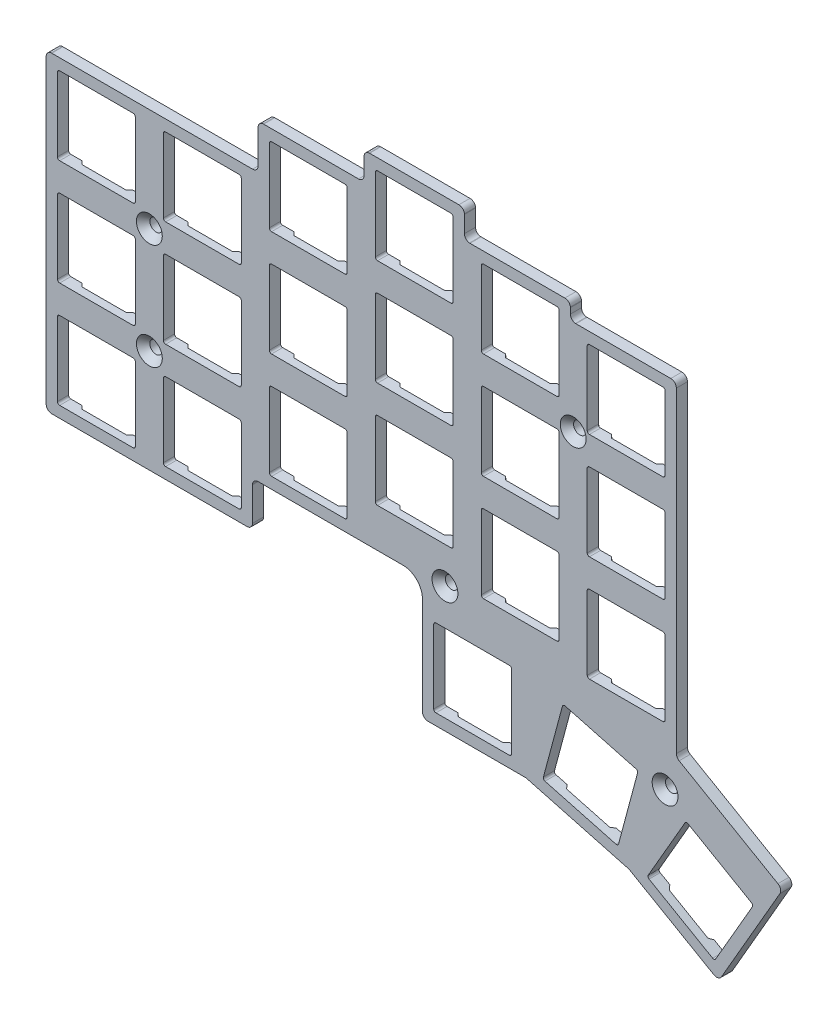
from build123d import *

# Parameters (mm, degrees)
BOSS_EXTRUDE1_START          = 5
BOSS_EXTRUDE1_DEPTH          = 2
CUT_EXTRUDE1_DEPTH           = 3
CUT_EXTRUDE2_DEPTH           = 3
CUT_EXTRUDE3_DEPTH           = 3
SKETCH6_R                    = 1.125
CUT_EXTRUDE4_DEPTH           = 3
CHAMFER3_SIZE                = 1.2
CUT_EXTRUDE5_DEPTH           = 0.6
CHAMFER6_SIZE                = 0.6
CUT_EXTRUDE6_DEPTH           = 0.6
CHAMFER7_SIZE                = 0.6
CIRPATTERN2_COUNT            = 3
CIRPATTERN2_ANGLE            = 30
CHAMFER7_OF_CIRPATTERN2_SIZE = 0.6
SKETCH_PATTERN4_DEPTH        = 0.6
SKETCH_PATTERN4_TAPER        = -45
SKETCH_PATTERN4_2_DEPTH      = 0.6
SKETCH_PATTERN4_2_TAPER      = -45
SKETCH_PATTERN4_3_DEPTH      = 0.6
SKETCH_PATTERN4_3_TAPER      = -45
SKETCH_PATTERN4_4_DEPTH      = 0.6
SKETCH_PATTERN4_4_TAPER      = -45
SKETCH_PATTERN4_5_DEPTH      = 0.6
SKETCH_PATTERN4_5_TAPER      = -45
SKETCH_PATTERN4_6_DEPTH      = 0.6
SKETCH_PATTERN4_6_TAPER      = -45
SKETCH_PATTERN4_7_DEPTH      = 0.6
SKETCH_PATTERN4_7_TAPER      = -45
SKETCH_PATTERN4_8_DEPTH      = 0.6
SKETCH_PATTERN4_8_TAPER      = -45
SKETCH_PATTERN4_9_DEPTH      = 0.6
SKETCH_PATTERN4_9_TAPER      = -45
SKETCH_PATTERN4_10_DEPTH     = 0.6
SKETCH_PATTERN4_10_TAPER     = -45
SKETCH_PATTERN4_11_DEPTH     = 0.6
SKETCH_PATTERN4_11_TAPER     = -45
SKETCH_PATTERN4_12_DEPTH     = 0.6
SKETCH_PATTERN4_12_TAPER     = -45
SKETCH_PATTERN4_13_DEPTH     = 0.6
SKETCH_PATTERN4_13_TAPER     = -45
SKETCH_PATTERN4_14_DEPTH     = 0.6
SKETCH_PATTERN4_14_TAPER     = -45
SKETCH_PATTERN4_15_DEPTH     = 0.6
SKETCH_PATTERN4_15_TAPER     = -45
SKETCH_PATTERN4_16_DEPTH     = 0.6
SKETCH_PATTERN4_16_TAPER     = -45
SKETCH_PATTERN4_17_DEPTH     = 0.6
SKETCH_PATTERN4_17_TAPER     = -45
SKETCH_PATTERN4_18_DEPTH     = 0.6
SKETCH_PATTERN4_18_TAPER     = -45
SKETCH_PATTERN4_19_DEPTH     = 0.6
SKETCH_PATTERN4_19_TAPER     = -45
SKETCH_PATTERN4_20_DEPTH     = 0.6
SKETCH_PATTERN4_20_TAPER     = -45
SKETCH_PATTERN4_21_DEPTH     = 0.6
SKETCH_PATTERN4_21_TAPER     = -45
SKETCH_PATTERN4_22_DEPTH     = 0.6
SKETCH_PATTERN4_22_TAPER     = -45
SKETCH_PATTERN4_23_DEPTH     = 0.6
SKETCH_PATTERN4_23_TAPER     = -45
SKETCH_PATTERN4_24_DEPTH     = 0.6
SKETCH_PATTERN4_24_TAPER     = -45
SKETCH_PATTERN4_25_DEPTH     = 0.6
SKETCH_PATTERN4_25_TAPER     = -45
SKETCH_PATTERN4_26_DEPTH     = 0.6
SKETCH_PATTERN4_26_TAPER     = -45
SKETCH_PATTERN4_27_DEPTH     = 0.6
SKETCH_PATTERN4_27_TAPER     = -45
SKETCH_PATTERN4_28_DEPTH     = 0.6
SKETCH_PATTERN4_28_TAPER     = -45
SKETCH_PATTERN4_29_DEPTH     = 0.6
SKETCH_PATTERN4_29_TAPER     = -45
SKETCH_PATTERN4_30_DEPTH     = 0.6
SKETCH_PATTERN4_30_TAPER     = -45
SKETCH_PATTERN4_31_DEPTH     = 0.6
SKETCH_PATTERN4_31_TAPER     = -45
SKETCH_PATTERN4_32_DEPTH     = 0.6
SKETCH_PATTERN4_32_TAPER     = -45
SKETCH_PATTERN4_33_DEPTH     = 0.6
SKETCH_PATTERN4_33_TAPER     = -45
SKETCH_PATTERN4_34_DEPTH     = 0.6
SKETCH_PATTERN4_34_TAPER     = -45
BOSS_EXTRUDE2_START          = 0.9
SKETCH12_R                   = 1.75
SKETCH12_R_2                 = 1.125
BOSS_EXTRUDE2_DEPTH          = 0.9
CHAMFER8_SIZE                = 0.5


with BuildPart() as part:
    # Sketch1 → Boss-Extrude1 (new body)
    with BuildSketch(Plane.XY.offset(BOSS_EXTRUDE1_START)):
        with BuildLine():
            Line((-43.412279, 85.144111), (-59.462279, 85.144111))
            Line((-59.462279, 85.144111), (-59.560533, 85.141704))
            ThreePointArc((-59.560533, 85.141704), (-60.204711116, 84.817640196), (-60.462279, 84.144111))
            Line((-60.462279, 84.144111), (-60.462279, 81.144111))
            Line((-60.462279, 81.144111), (-60.464686, 81.045857))
            ThreePointArc((-60.464686, 81.045857), (-60.788749804, 80.401678884), (-61.462279, 80.144111))
            Line((-61.462279, 80.144111), (-67.612279, 80.144111))
            Line((-67.612279, 80.144111), (-72.362279, 80.144111))
            Line((-72.362279, 80.144111), (-78.512279, 80.144111))
            Line((-78.512279, 80.144111), (-78.610533, 80.141704))
            ThreePointArc((-78.610533, 80.141704), (-79.254711116, 79.817640196), (-79.512279, 79.144111))
            Line((-79.512279, 79.144111), (-79.512279, 73.144111))
            Line((-79.512279, 73.144111), (-79.514686, 73.045857))
            ThreePointArc((-79.514686, 73.045857), (-79.838749804, 72.401678884), (-80.512279, 72.144111))
            Line((-80.512279, 72.144111), (-116.612279, 72.144111))
            Line((-116.612279, 72.144111), (-116.710533, 72.141704))
            ThreePointArc((-116.710533, 72.141704), (-117.354711116, 71.817640196), (-117.612279, 71.144111))
            Line((-117.612279, 71.144111), (-117.612279, 16.994111))
            Line((-117.612279, 16.994111), (-117.609872, 16.895857))
            ThreePointArc((-117.609872, 16.895857), (-117.285808196, 16.251678884), (-116.612279, 15.994111))
            Line((-116.612279, 15.994111), (-101.437279, 15.994111))
            Line((-101.437279, 15.994111), (-96.687279, 15.994111))
            Line((-96.687279, 15.994111), (-81.512279, 15.994111))
            Line((-81.512279, 15.994111), (-81.414025, 15.996518))
            ThreePointArc((-81.414025, 15.996518), (-80.769846884, 16.320581804), (-80.512279, 16.994111))
            Line((-80.512279, 16.994111), (-80.512279, 22.994111))
            Line((-80.512279, 22.994111), (-80.509872, 23.092365))
            ThreePointArc((-80.509872, 23.092365), (-80.185808196, 23.736543116), (-79.512279, 23.994111))
            Line((-79.512279, 23.994111), (-53.462279, 23.994111))
            Line((-53.462279, 23.994111), (-53.278977, 23.991713))
            ThreePointArc((-53.278977, 23.991713), (-50.922055604, 22.905352629), (-49.962279, 20.494111))
            Line((-49.962279, 20.494111), (-49.962279, 2.944111))
            Line((-49.962279, 2.944111), (-49.959872, 2.845857))
            ThreePointArc((-49.959872, 2.845857), (-49.635808196, 2.201678884), (-48.962279, 1.944111))
            Line((-48.962279, 1.944111), (-31.346453, 1.944111))
            Line((-31.346453, 1.944111), (-12.818399, -3.020466))
            Line((-12.818399, -3.020466), (2.437354, -11.828379))
            Line((2.437354, -11.828379), (2.523644, -11.875428))
            ThreePointArc((2.523644, -11.875428), (3.24353, -11.916930612), (3.803337, -11.462426))
            Line((3.803337, -11.462426), (17.333763, 11.972959))
            Line((17.333763, 11.972959), (17.375769, 12.049527))
            ThreePointArc((17.375769, 12.049527), (17.445855835, 12.255982525), (17.467721, 12.472911))
            Line((17.467721, 12.472911), (17.467721, 76.144111))
            Line((17.467721, 76.144111), (17.465314, 76.242365))
            ThreePointArc((17.465314, 76.242365), (17.141250196, 76.886543116), (16.467721, 77.144111))
            Line((16.467721, 77.144111), (-22.362279, 77.144111))
            Line((-22.362279, 77.144111), (-22.460533, 77.146518))
            ThreePointArc((-22.460533, 77.146518), (-23.104711116, 77.470581804), (-23.362279, 78.144111))
            Line((-23.362279, 78.144111), (-23.362279, 79.144111))
            Line((-23.362279, 79.144111), (-23.364686, 79.242365))
            ThreePointArc((-23.364686, 79.242365), (-23.688749804, 79.886543116), (-24.362279, 80.144111))
            Line((-24.362279, 80.144111), (-30.512279, 80.144111))
            Line((-30.512279, 80.144111), (-35.262279, 80.144111))
            Line((-35.262279, 80.144111), (-41.412279, 80.144111))
            Line((-41.412279, 80.144111), (-41.510533, 80.146518))
            ThreePointArc((-41.510533, 80.146518), (-42.154711116, 80.470581804), (-42.412279, 81.144111))
            Line((-42.412279, 81.144111), (-42.412279, 84.144111))
            Line((-42.412279, 84.144111), (-42.414686, 84.242365))
            ThreePointArc((-42.414686, 84.242365), (-42.738749804, 84.886543116), (-43.412279, 85.144111))
        make_face()
    extrude(amount=-BOSS_EXTRUDE1_DEPTH)

    # Sketch2 → Cut-Extrude1 (cut)
    with BuildSketch(Plane.XY.offset(5)):
        with BuildLine():
            Line((-101.987279, 56.119111), (-115.187279, 56.119111))
            ThreePointArc((-115.187279, 56.119111), (-115.470121712, 56.236268288), (-115.587279, 56.519111))
            Line((-115.587279, 56.519111), (-115.587279, 69.719111))
            ThreePointArc((-115.587279, 69.719111), (-115.470121712, 70.001953712), (-115.187279, 70.119111))
            Line((-115.187279, 70.119111), (-101.987279, 70.119111))
            ThreePointArc((-101.987279, 70.119111), (-101.704436288, 70.001953712), (-101.587279, 69.719111))
            Line((-101.587279, 69.719111), (-101.587279, 56.519111))
            ThreePointArc((-101.587279, 56.519111), (-101.704436288, 56.236268288), (-101.987279, 56.119111))
        make_face()
    cut_extrude1 = extrude(amount=-CUT_EXTRUDE1_DEPTH, mode=Mode.SUBTRACT)

    # Sketch-Pattern1: Cut-Extrude1 at 18 more places
    with Locations((0, -38.1, 0), (0, -19.05, 0), (19.05, -38.1, 0), (19.05, -19.05, 0), (19.05, 0, 0), (38.1, -11.05, 0), (38.1, -30.1, 0), (57.15, -25.1, 0), (57.15, -6.05, 0), (57.15, 13, 0), (38.1, 8, 0), (76.2, 8, 0), (76.2, -11.05, 0), (76.2, -30.1, 0), (67.65, -52.15, 0), (95.25, -33.1, 0), (95.25, -14.05, 0), (95.25, 5, 0)):
        add(cut_extrude1, mode=Mode.SUBTRACT)

    # Sketch4 → Cut-Extrude2 (cut)
    with BuildSketch(Plane.XY.offset(5)):
        with BuildLine():
            Line((-24.309961183, 16.648989457), (-11.559740258, 13.23257813))
            ThreePointArc((-11.559740258, 13.23257813), (-11.316857713, 13.046207801), (-11.276897543, 12.742680183))
            Line((-11.276897543, 12.742680183), (-14.69330887, -0.007540742))
            ThreePointArc((-14.69330887, -0.007540742), (-14.879679199, -0.250423287), (-15.183206817, -0.290383457))
            Line((-15.183206817, -0.290383457), (-27.933427742, 3.12602787))
            ThreePointArc((-27.933427742, 3.12602787), (-28.176310287, 3.312398199), (-28.216270457, 3.615925817))
            Line((-28.216270457, 3.615925817), (-24.79985913, 16.366146742))
            ThreePointArc((-24.79985913, 16.366146742), (-24.613488801, 16.609029287), (-24.309961183, 16.648989457))
        make_face()
        with BuildLine():
            Line((2.215767665, -9.362177826), (-9.215767665, -2.762177826))
            ThreePointArc((-9.215767665, -2.762177826), (-9.402137995, -2.519295283), (-9.362177826, -2.215767665))
            Line((-9.362177826, -2.215767665), (-2.762177826, 9.215767665))
            ThreePointArc((-2.762177826, 9.215767665), (-2.519295283, 9.402137995), (-2.215767665, 9.362177826))
            Line((-2.215767665, 9.362177826), (9.215767665, 2.762177826))
            ThreePointArc((9.215767665, 2.762177826), (9.402137995, 2.519295283), (9.362177826, 2.215767665))
            Line((9.362177826, 2.215767665), (2.762177826, -9.215767665))
            ThreePointArc((2.762177826, -9.215767665), (2.519295283, -9.402137995), (2.215767665, -9.362177826))
        make_face()
    extrude(amount=-CUT_EXTRUDE2_DEPTH, mode=Mode.SUBTRACT)

    # Sketch5 → Cut-Extrude3 (cut)
    with BuildSketch(Plane.XY.offset(5)):
        with BuildLine():
            Line((-12.903744032, 77.144111), (-5.312279, 77.144111))
            ThreePointArc((-5.312279, 77.144111), (-4.605172219, 76.851217781), (-4.312279, 76.144111))
            Line((-4.312279, 76.144111), (-4.312279, 19.232853248))
            ThreePointArc((-4.312279, 19.232853248), (-4.178304404, 18.732853248), (-3.812279, 18.366827844))
            Line((-3.812279, 18.366827844), (13.949853399, 8.111855922))
            ThreePointArc((13.949853399, 8.111855922), (14.415779225, 7.504649564), (14.315878803, 6.745830519))
            Line((14.315878803, 6.745830519), (7.754308024, -4.619143447))
            Line((7.754308024, -4.619143447), (24.75284052, -3.869886779))
            Line((24.75284052, -3.869886779), (24.75284052, 82.882476135))
            Line((24.75284052, 82.882476135), (-12.903744032, 94.38391813))
            Line((-12.903744032, 94.38391813), (-12.903744032, 77.144111))
        make_face()
    extrude(amount=-CUT_EXTRUDE3_DEPTH, mode=Mode.SUBTRACT)

    # Sketch6 → Cut-Extrude4 (cut)
    with BuildSketch(Plane(origin=(0, 0, 3), x_dir=(-1, 0, 0), z_dir=(0, 0, -1))):
        with Locations((99.062279, 34.544111)):
            Circle(SKETCH6_R)
        with Locations((99.062279, 53.594111)):
            Circle(SKETCH6_R)
        with Locations((45.912279, 24.494111)):
            Circle(SKETCH6_R)
        with Locations((6.333841, 12.634642)):
            Circle(SKETCH6_R)
        with Locations((22.862279, 60.094111)):
            Circle(SKETCH6_R)
    extrude(amount=-CUT_EXTRUDE4_DEPTH, mode=Mode.SUBTRACT)

    # Chamfer3
    chamfer3_edges = [part.edges().sort_by_distance(p)[0] for p in [
        (-21.737279, 60.094111, 5),
        (-5.208841, 12.634642, 5),
        (-44.787279, 24.494111, 5),
        (-97.937279, 53.594111, 5),
        (-97.937279, 34.544111, 5),
    ]]
    chamfer(chamfer3_edges, length=CHAMFER3_SIZE)

    # Sketch7 → Cut-Extrude5 (cut)
    with BuildSketch(Plane(origin=(0, 0, 3), x_dir=(-1, 0, 0), z_dir=(0, 0, -1))):
        with BuildLine():
            Line((111.787279, 71.119111), (105.387279, 71.119111))
            ThreePointArc((105.387279, 71.119111), (104.821593575, 70.884796425), (104.587279, 70.319111))
            Line((104.587279, 70.319111), (104.587279, 55.919111))
            ThreePointArc((104.587279, 55.919111), (104.821593575, 55.353425575), (105.387279, 55.119111))
            Line((105.387279, 55.119111), (111.787279, 55.119111))
            ThreePointArc((111.787279, 55.119111), (112.352964425, 55.353425575), (112.587279, 55.919111))
            Line((112.587279, 55.919111), (112.587279, 70.319111))
            ThreePointArc((112.587279, 70.319111), (112.352964425, 70.884796425), (111.787279, 71.119111))
        make_face()
    extrude(amount=-CUT_EXTRUDE5_DEPTH, mode=Mode.SUBTRACT)

    # Chamfer6
    chamfer6_edges = [part.edges().sort_by_distance(p)[0] for p in [
        (-104.587279, 56.019111, 3),
        (-112.587279, 56.019111, 3),
        (-104.821593575, 55.353425575, 3),
        (-112.352964425, 55.353425575, 3),
        (-108.587279, 55.119111, 3),
        (-112.587279, 70.219111, 3),
        (-104.587279, 70.219111, 3),
        (-112.352964425, 70.884796425, 3),
        (-104.821593575, 70.884796425, 3),
        (-108.587279, 71.119111, 3),
    ]]
    chamfer(chamfer6_edges, length=CHAMFER6_SIZE - 0.0001)  # a hair under: the kernel refuses the full size

    # Sketch10 → Cut-Extrude6 (cut)
    with BuildSketch(Plane(origin=(0, 0, 3), x_dir=(-1, 0, 0), z_dir=(0, 0, -1))):
        with BuildLine():
            Line((44.137279, 18.969111), (37.737279, 18.969111))
            ThreePointArc((37.737279, 18.969111), (37.171593575, 18.734796425), (36.937279, 18.169111))
            Line((36.937279, 18.169111), (36.937279, 3.769111))
            ThreePointArc((36.937279, 3.769111), (37.171593575, 3.203425575), (37.737279, 2.969111))
            Line((37.737279, 2.969111), (44.137279, 2.969111))
            ThreePointArc((44.137279, 2.969111), (44.702964425, 3.203425575), (44.937279, 3.769111))
            Line((44.937279, 3.769111), (44.937279, 18.169111))
            ThreePointArc((44.937279, 18.169111), (44.702964425, 18.734796425), (44.137279, 18.969111))
        make_face()
    cut_extrude6 = extrude(amount=-CUT_EXTRUDE6_DEPTH, mode=Mode.SUBTRACT)

    # Chamfer7
    chamfer7_edges = [part.edges().sort_by_distance(p)[0] for p in [
        (-36.937279, 3.869111, 3),
        (-36.937279, 18.069111, 3),
        (-44.937279, 3.869111, 3),
        (-37.171593575, 3.203425575, 3),
        (-44.702964425, 3.203425575, 3),
        (-40.937279, 2.969111, 3),
        (-44.937279, 18.069111, 3),
        (-44.702964425, 18.734796425, 3),
        (-37.171593575, 18.734796425, 3),
        (-40.937279, 18.969111, 3),
    ]]
    chamfer(chamfer7_edges, length=CHAMFER7_SIZE - 0.0001)  # a hair under: the kernel refuses the full size

    # CirPattern2: Cut-Extrude6 ×3 about axis
    cirpattern2_axis = Axis((-40.937279, -70.90544602, 0), (0, 0, -1))
    for i in range(1, CIRPATTERN2_COUNT):
        add(cut_extrude6.rotate(cirpattern2_axis, i * CIRPATTERN2_ANGLE / (CIRPATTERN2_COUNT - 1)), mode=Mode.SUBTRACT)

    # Chamfer7 of CirPattern2
    chamfer7_of_cirpattern2_edges = [part.edges().sort_by_distance(p)[0] for p in [
        (-17.72049625, 0.28595357, 3),
        (-14.04526581, 14.002100303, 3),
        (-25.447902866, 2.35650591, 3),
        (-18.119118815, -0.296404095, 3),
        (-25.393864426, 1.652858117, 3),
        (-21.817136695, 0.451896511, 3),
        (-21.772672426, 16.072652643, 3),
        (-21.374049853, 16.655010338, 3),
        (-14.099304242, 14.705748127, 3),
        (-17.676031973, 15.906709732, 3),
        (-0.085898875, -8.148780084, 3),
        (7.014101125, 4.14878065, 3),
        (-7.014102105, -4.148780084, 3),
        (-0.621663962, -8.608123285, 3),
        (-7.144022443, -4.84243786, 3),
        (-4.00000049, -6.928202947, 3),
        (0.085897895, 8.14878065, 3),
        (0.621662982, 8.608123851, 3),
        (7.144021463, 4.842438426, 3),
        (3.99999951, 6.928203513, 3),
    ]]
    chamfer(chamfer7_of_cirpattern2_edges, length=CHAMFER7_OF_CIRPATTERN2_SIZE - 0.0001)  # a hair under: the kernel refuses the full size

    # Sketch-Pattern4: read off the stored shape, not the designer's step
    # Sketch-Pattern4 outline → Sketch-Pattern4 (cut)
    with BuildSketch(Plane.XY.offset(3.6)):
        with BuildLine():
            Line((-55.437279, 83.119111), (-47.437279, 83.119111))
            Line((-47.437279, 83.119111), (-47.437279, 83.319111))
            ThreePointArc((-47.437279, 83.319111), (-47.671593575, 83.884796425), (-48.237279, 84.119111))
            Line((-48.237279, 84.119111), (-54.637279, 84.119111))
            ThreePointArc((-54.637279, 84.119111), (-55.202964425, 83.884796425), (-55.437279, 83.319111))
            Line((-55.437279, 83.319111), (-55.437279, 83.119111))
        make_face()
    extrude(amount=-SKETCH_PATTERN4_DEPTH, taper=SKETCH_PATTERN4_TAPER, mode=Mode.SUBTRACT)

    # Sketch-Pattern4 2 outline → Sketch-Pattern4 2 (cut)
    with BuildSketch(Plane.XY.offset(3.6)):
        with BuildLine():
            Line((-47.437279, 69.119111), (-55.437279, 69.119111))
            Line((-55.437279, 69.119111), (-55.437279, 68.919111))
            ThreePointArc((-55.437279, 68.919111), (-55.202964425, 68.353425575), (-54.637279, 68.119111))
            Line((-54.637279, 68.119111), (-48.237279, 68.119111))
            ThreePointArc((-48.237279, 68.119111), (-47.671593575, 68.353425575), (-47.437279, 68.919111))
            Line((-47.437279, 68.919111), (-47.437279, 69.119111))
        make_face()
    extrude(amount=-SKETCH_PATTERN4_2_DEPTH, taper=SKETCH_PATTERN4_2_TAPER, mode=Mode.SUBTRACT)

    # Sketch-Pattern4 3 outline → Sketch-Pattern4 3 (cut)
    with BuildSketch(Plane.XY.offset(3.6)):
        with BuildLine():
            Line((-74.487279, 78.119111), (-66.487279, 78.119111))
            Line((-66.487279, 78.119111), (-66.487279, 78.319111))
            ThreePointArc((-66.487279, 78.319111), (-66.721593575, 78.884796425), (-67.287279, 79.119111))
            Line((-67.287279, 79.119111), (-73.687279, 79.119111))
            ThreePointArc((-73.687279, 79.119111), (-74.252964425, 78.884796425), (-74.487279, 78.319111))
            Line((-74.487279, 78.319111), (-74.487279, 78.119111))
        make_face()
    extrude(amount=-SKETCH_PATTERN4_3_DEPTH, taper=SKETCH_PATTERN4_3_TAPER, mode=Mode.SUBTRACT)

    # Sketch-Pattern4 4 outline → Sketch-Pattern4 4 (cut)
    with BuildSketch(Plane.XY.offset(3.6)):
        with BuildLine():
            Line((-66.487279, 64.119111), (-74.487279, 64.119111))
            Line((-74.487279, 64.119111), (-74.487279, 63.919111))
            ThreePointArc((-74.487279, 63.919111), (-74.252964425, 63.353425575), (-73.687279, 63.119111))
            Line((-73.687279, 63.119111), (-67.287279, 63.119111))
            ThreePointArc((-67.287279, 63.119111), (-66.721593575, 63.353425575), (-66.487279, 63.919111))
            Line((-66.487279, 63.919111), (-66.487279, 64.119111))
        make_face()
    extrude(amount=-SKETCH_PATTERN4_4_DEPTH, taper=SKETCH_PATTERN4_4_TAPER, mode=Mode.SUBTRACT)

    # Sketch-Pattern4 5 outline → Sketch-Pattern4 5 (cut)
    with BuildSketch(Plane.XY.offset(3.6)):
        with BuildLine():
            Line((-36.387279, 78.119111), (-28.387279, 78.119111))
            Line((-28.387279, 78.119111), (-28.387279, 78.319111))
            ThreePointArc((-28.387279, 78.319111), (-28.621593575, 78.884796425), (-29.187279, 79.119111))
            Line((-29.187279, 79.119111), (-35.587279, 79.119111))
            ThreePointArc((-35.587279, 79.119111), (-36.152964425, 78.884796425), (-36.387279, 78.319111))
            Line((-36.387279, 78.319111), (-36.387279, 78.119111))
        make_face()
    extrude(amount=-SKETCH_PATTERN4_5_DEPTH, taper=SKETCH_PATTERN4_5_TAPER, mode=Mode.SUBTRACT)

    # Sketch-Pattern4 6 outline → Sketch-Pattern4 6 (cut)
    with BuildSketch(Plane.XY.offset(3.6)):
        with BuildLine():
            Line((-28.387279, 64.119111), (-36.387279, 64.119111))
            Line((-36.387279, 64.119111), (-36.387279, 63.919111))
            ThreePointArc((-36.387279, 63.919111), (-36.152964425, 63.353425575), (-35.587279, 63.119111))
            Line((-35.587279, 63.119111), (-29.187279, 63.119111))
            ThreePointArc((-29.187279, 63.119111), (-28.621593575, 63.353425575), (-28.387279, 63.919111))
            Line((-28.387279, 63.919111), (-28.387279, 64.119111))
        make_face()
    extrude(amount=-SKETCH_PATTERN4_6_DEPTH, taper=SKETCH_PATTERN4_6_TAPER, mode=Mode.SUBTRACT)

    # Sketch-Pattern4 7 outline → Sketch-Pattern4 7 (cut)
    with BuildSketch(Plane.XY.offset(3.6)):
        with BuildLine():
            Line((-36.387279, 59.069111), (-28.387279, 59.069111))
            Line((-28.387279, 59.069111), (-28.387279, 59.269111))
            ThreePointArc((-28.387279, 59.269111), (-28.621593575, 59.834796425), (-29.187279, 60.069111))
            Line((-29.187279, 60.069111), (-35.587279, 60.069111))
            ThreePointArc((-35.587279, 60.069111), (-36.152964425, 59.834796425), (-36.387279, 59.269111))
            Line((-36.387279, 59.269111), (-36.387279, 59.069111))
        make_face()
    extrude(amount=-SKETCH_PATTERN4_7_DEPTH, taper=SKETCH_PATTERN4_7_TAPER, mode=Mode.SUBTRACT)

    # Sketch-Pattern4 8 outline → Sketch-Pattern4 8 (cut)
    with BuildSketch(Plane.XY.offset(3.6)):
        with BuildLine():
            Line((-28.387279, 45.069111), (-36.387279, 45.069111))
            Line((-36.387279, 45.069111), (-36.387279, 44.869111))
            ThreePointArc((-36.387279, 44.869111), (-36.152964425, 44.303425575), (-35.587279, 44.069111))
            Line((-35.587279, 44.069111), (-29.187279, 44.069111))
            ThreePointArc((-29.187279, 44.069111), (-28.621593575, 44.303425575), (-28.387279, 44.869111))
            Line((-28.387279, 44.869111), (-28.387279, 45.069111))
        make_face()
    extrude(amount=-SKETCH_PATTERN4_8_DEPTH, taper=SKETCH_PATTERN4_8_TAPER, mode=Mode.SUBTRACT)

    # Sketch-Pattern4 9 outline → Sketch-Pattern4 9 (cut)
    with BuildSketch(Plane.XY.offset(3.6)):
        with BuildLine():
            Line((-36.387279, 40.019111), (-28.387279, 40.019111))
            Line((-28.387279, 40.019111), (-28.387279, 40.219111))
            ThreePointArc((-28.387279, 40.219111), (-28.621593575, 40.784796425), (-29.187279, 41.019111))
            Line((-29.187279, 41.019111), (-35.587279, 41.019111))
            ThreePointArc((-35.587279, 41.019111), (-36.152964425, 40.784796425), (-36.387279, 40.219111))
            Line((-36.387279, 40.219111), (-36.387279, 40.019111))
        make_face()
    extrude(amount=-SKETCH_PATTERN4_9_DEPTH, taper=SKETCH_PATTERN4_9_TAPER, mode=Mode.SUBTRACT)

    # Sketch-Pattern4 10 outline → Sketch-Pattern4 10 (cut)
    with BuildSketch(Plane.XY.offset(3.6)):
        with BuildLine():
            Line((-28.387279, 26.019111), (-36.387279, 26.019111))
            Line((-36.387279, 26.019111), (-36.387279, 25.819111))
            ThreePointArc((-36.387279, 25.819111), (-36.152964425, 25.253425575), (-35.587279, 25.019111))
            Line((-35.587279, 25.019111), (-29.187279, 25.019111))
            ThreePointArc((-29.187279, 25.019111), (-28.621593575, 25.253425575), (-28.387279, 25.819111))
            Line((-28.387279, 25.819111), (-28.387279, 26.019111))
        make_face()
    extrude(amount=-SKETCH_PATTERN4_10_DEPTH, taper=SKETCH_PATTERN4_10_TAPER, mode=Mode.SUBTRACT)

    # Sketch-Pattern4 11 outline → Sketch-Pattern4 11 (cut)
    with BuildSketch(Plane.XY.offset(3.6)):
        with BuildLine():
            Line((-17.337279, 37.019111), (-9.337279, 37.019111))
            Line((-9.337279, 37.019111), (-9.337279, 37.219111))
            ThreePointArc((-9.337279, 37.219111), (-9.571593575, 37.784796425), (-10.137279, 38.019111))
            Line((-10.137279, 38.019111), (-16.537279, 38.019111))
            ThreePointArc((-16.537279, 38.019111), (-17.102964425, 37.784796425), (-17.337279, 37.219111))
            Line((-17.337279, 37.219111), (-17.337279, 37.019111))
        make_face()
    extrude(amount=-SKETCH_PATTERN4_11_DEPTH, taper=SKETCH_PATTERN4_11_TAPER, mode=Mode.SUBTRACT)

    # Sketch-Pattern4 12 outline → Sketch-Pattern4 12 (cut)
    with BuildSketch(Plane.XY.offset(3.6)):
        with BuildLine():
            Line((-9.337279, 23.019111), (-17.337279, 23.019111))
            Line((-17.337279, 23.019111), (-17.337279, 22.819111))
            ThreePointArc((-17.337279, 22.819111), (-17.102964425, 22.253425575), (-16.537279, 22.019111))
            Line((-16.537279, 22.019111), (-10.137279, 22.019111))
            ThreePointArc((-10.137279, 22.019111), (-9.571593575, 22.253425575), (-9.337279, 22.819111))
            Line((-9.337279, 22.819111), (-9.337279, 23.019111))
        make_face()
    extrude(amount=-SKETCH_PATTERN4_12_DEPTH, taper=SKETCH_PATTERN4_12_TAPER, mode=Mode.SUBTRACT)

    # Sketch-Pattern4 13 outline → Sketch-Pattern4 13 (cut)
    with BuildSketch(Plane.XY.offset(3.6)):
        with BuildLine():
            Line((-17.337279, 56.069111), (-9.337279, 56.069111))
            Line((-9.337279, 56.069111), (-9.337279, 56.269111))
            ThreePointArc((-9.337279, 56.269111), (-9.571593575, 56.834796425), (-10.137279, 57.069111))
            Line((-10.137279, 57.069111), (-16.537279, 57.069111))
            ThreePointArc((-16.537279, 57.069111), (-17.102964425, 56.834796425), (-17.337279, 56.269111))
            Line((-17.337279, 56.269111), (-17.337279, 56.069111))
        make_face()
    extrude(amount=-SKETCH_PATTERN4_13_DEPTH, taper=SKETCH_PATTERN4_13_TAPER, mode=Mode.SUBTRACT)

    # Sketch-Pattern4 14 outline → Sketch-Pattern4 14 (cut)
    with BuildSketch(Plane.XY.offset(3.6)):
        with BuildLine():
            Line((-9.337279, 42.069111), (-17.337279, 42.069111))
            Line((-17.337279, 42.069111), (-17.337279, 41.869111))
            ThreePointArc((-17.337279, 41.869111), (-17.102964425, 41.303425575), (-16.537279, 41.069111))
            Line((-16.537279, 41.069111), (-10.137279, 41.069111))
            ThreePointArc((-10.137279, 41.069111), (-9.571593575, 41.303425575), (-9.337279, 41.869111))
            Line((-9.337279, 41.869111), (-9.337279, 42.069111))
        make_face()
    extrude(amount=-SKETCH_PATTERN4_14_DEPTH, taper=SKETCH_PATTERN4_14_TAPER, mode=Mode.SUBTRACT)

    # Sketch-Pattern4 15 outline → Sketch-Pattern4 15 (cut)
    with BuildSketch(Plane.XY.offset(3.6)):
        with BuildLine():
            Line((-55.437279, 64.069111), (-47.437279, 64.069111))
            Line((-47.437279, 64.069111), (-47.437279, 64.269111))
            ThreePointArc((-47.437279, 64.269111), (-47.671593575, 64.834796425), (-48.237279, 65.069111))
            Line((-48.237279, 65.069111), (-54.637279, 65.069111))
            ThreePointArc((-54.637279, 65.069111), (-55.202964425, 64.834796425), (-55.437279, 64.269111))
            Line((-55.437279, 64.269111), (-55.437279, 64.069111))
        make_face()
    extrude(amount=-SKETCH_PATTERN4_15_DEPTH, taper=SKETCH_PATTERN4_15_TAPER, mode=Mode.SUBTRACT)

    # Sketch-Pattern4 16 outline → Sketch-Pattern4 16 (cut)
    with BuildSketch(Plane.XY.offset(3.6)):
        with BuildLine():
            Line((-47.437279, 50.069111), (-55.437279, 50.069111))
            Line((-55.437279, 50.069111), (-55.437279, 49.869111))
            ThreePointArc((-55.437279, 49.869111), (-55.202964425, 49.303425575), (-54.637279, 49.069111))
            Line((-54.637279, 49.069111), (-48.237279, 49.069111))
            ThreePointArc((-48.237279, 49.069111), (-47.671593575, 49.303425575), (-47.437279, 49.869111))
            Line((-47.437279, 49.869111), (-47.437279, 50.069111))
        make_face()
    extrude(amount=-SKETCH_PATTERN4_16_DEPTH, taper=SKETCH_PATTERN4_16_TAPER, mode=Mode.SUBTRACT)

    # Sketch-Pattern4 17 outline → Sketch-Pattern4 17 (cut)
    with BuildSketch(Plane.XY.offset(3.6)):
        with BuildLine():
            Line((-55.437279, 45.019111), (-47.437279, 45.019111))
            Line((-47.437279, 45.019111), (-47.437279, 45.219111))
            ThreePointArc((-47.437279, 45.219111), (-47.671593575, 45.784796425), (-48.237279, 46.019111))
            Line((-48.237279, 46.019111), (-54.637279, 46.019111))
            ThreePointArc((-54.637279, 46.019111), (-55.202964425, 45.784796425), (-55.437279, 45.219111))
            Line((-55.437279, 45.219111), (-55.437279, 45.019111))
        make_face()
    extrude(amount=-SKETCH_PATTERN4_17_DEPTH, taper=SKETCH_PATTERN4_17_TAPER, mode=Mode.SUBTRACT)

    # Sketch-Pattern4 18 outline → Sketch-Pattern4 18 (cut)
    with BuildSketch(Plane.XY.offset(3.6)):
        with BuildLine():
            Line((-47.437279, 31.019111), (-55.437279, 31.019111))
            Line((-55.437279, 31.019111), (-55.437279, 30.819111))
            ThreePointArc((-55.437279, 30.819111), (-55.202964425, 30.253425575), (-54.637279, 30.019111))
            Line((-54.637279, 30.019111), (-48.237279, 30.019111))
            ThreePointArc((-48.237279, 30.019111), (-47.671593575, 30.253425575), (-47.437279, 30.819111))
            Line((-47.437279, 30.819111), (-47.437279, 31.019111))
        make_face()
    extrude(amount=-SKETCH_PATTERN4_18_DEPTH, taper=SKETCH_PATTERN4_18_TAPER, mode=Mode.SUBTRACT)

    # Sketch-Pattern4 19 outline → Sketch-Pattern4 19 (cut)
    with BuildSketch(Plane.XY.offset(3.6)):
        with BuildLine():
            Line((-74.487279, 40.019111), (-66.487279, 40.019111))
            Line((-66.487279, 40.019111), (-66.487279, 40.219111))
            ThreePointArc((-66.487279, 40.219111), (-66.721593575, 40.784796425), (-67.287279, 41.019111))
            Line((-67.287279, 41.019111), (-73.687279, 41.019111))
            ThreePointArc((-73.687279, 41.019111), (-74.252964425, 40.784796425), (-74.487279, 40.219111))
            Line((-74.487279, 40.219111), (-74.487279, 40.019111))
        make_face()
    extrude(amount=-SKETCH_PATTERN4_19_DEPTH, taper=SKETCH_PATTERN4_19_TAPER, mode=Mode.SUBTRACT)

    # Sketch-Pattern4 20 outline → Sketch-Pattern4 20 (cut)
    with BuildSketch(Plane.XY.offset(3.6)):
        with BuildLine():
            Line((-66.487279, 26.019111), (-74.487279, 26.019111))
            Line((-74.487279, 26.019111), (-74.487279, 25.819111))
            ThreePointArc((-74.487279, 25.819111), (-74.252964425, 25.253425575), (-73.687279, 25.019111))
            Line((-73.687279, 25.019111), (-67.287279, 25.019111))
            ThreePointArc((-67.287279, 25.019111), (-66.721593575, 25.253425575), (-66.487279, 25.819111))
            Line((-66.487279, 25.819111), (-66.487279, 26.019111))
        make_face()
    extrude(amount=-SKETCH_PATTERN4_20_DEPTH, taper=SKETCH_PATTERN4_20_TAPER, mode=Mode.SUBTRACT)

    # Sketch-Pattern4 21 outline → Sketch-Pattern4 21 (cut)
    with BuildSketch(Plane.XY.offset(3.6)):
        with BuildLine():
            Line((-74.487279, 59.069111), (-66.487279, 59.069111))
            Line((-66.487279, 59.069111), (-66.487279, 59.269111))
            ThreePointArc((-66.487279, 59.269111), (-66.721593575, 59.834796425), (-67.287279, 60.069111))
            Line((-67.287279, 60.069111), (-73.687279, 60.069111))
            ThreePointArc((-73.687279, 60.069111), (-74.252964425, 59.834796425), (-74.487279, 59.269111))
            Line((-74.487279, 59.269111), (-74.487279, 59.069111))
        make_face()
    extrude(amount=-SKETCH_PATTERN4_21_DEPTH, taper=SKETCH_PATTERN4_21_TAPER, mode=Mode.SUBTRACT)

    # Sketch-Pattern4 22 outline → Sketch-Pattern4 22 (cut)
    with BuildSketch(Plane.XY.offset(3.6)):
        with BuildLine():
            Line((-66.487279, 45.069111), (-74.487279, 45.069111))
            Line((-74.487279, 45.069111), (-74.487279, 44.869111))
            ThreePointArc((-74.487279, 44.869111), (-74.252964425, 44.303425575), (-73.687279, 44.069111))
            Line((-73.687279, 44.069111), (-67.287279, 44.069111))
            ThreePointArc((-67.287279, 44.069111), (-66.721593575, 44.303425575), (-66.487279, 44.869111))
            Line((-66.487279, 44.869111), (-66.487279, 45.069111))
        make_face()
    extrude(amount=-SKETCH_PATTERN4_22_DEPTH, taper=SKETCH_PATTERN4_22_TAPER, mode=Mode.SUBTRACT)

    # Sketch-Pattern4 23 outline → Sketch-Pattern4 23 (cut)
    with BuildSketch(Plane.XY.offset(3.6)):
        with BuildLine():
            Line((-112.587279, 51.069111), (-104.587279, 51.069111))
            Line((-104.587279, 51.069111), (-104.587279, 51.269111))
            ThreePointArc((-104.587279, 51.269111), (-104.821593575, 51.834796425), (-105.387279, 52.069111))
            Line((-105.387279, 52.069111), (-111.787279, 52.069111))
            ThreePointArc((-111.787279, 52.069111), (-112.352964425, 51.834796425), (-112.587279, 51.269111))
            Line((-112.587279, 51.269111), (-112.587279, 51.069111))
        make_face()
    extrude(amount=-SKETCH_PATTERN4_23_DEPTH, taper=SKETCH_PATTERN4_23_TAPER, mode=Mode.SUBTRACT)

    # Sketch-Pattern4 24 outline → Sketch-Pattern4 24 (cut)
    with BuildSketch(Plane.XY.offset(3.6)):
        with BuildLine():
            Line((-104.587279, 37.069111), (-112.587279, 37.069111))
            Line((-112.587279, 37.069111), (-112.587279, 36.869111))
            ThreePointArc((-112.587279, 36.869111), (-112.352964425, 36.303425575), (-111.787279, 36.069111))
            Line((-111.787279, 36.069111), (-105.387279, 36.069111))
            ThreePointArc((-105.387279, 36.069111), (-104.821593575, 36.303425575), (-104.587279, 36.869111))
            Line((-104.587279, 36.869111), (-104.587279, 37.069111))
        make_face()
    extrude(amount=-SKETCH_PATTERN4_24_DEPTH, taper=SKETCH_PATTERN4_24_TAPER, mode=Mode.SUBTRACT)

    # Sketch-Pattern4 25 outline → Sketch-Pattern4 25 (cut)
    with BuildSketch(Plane.XY.offset(3.6)):
        with BuildLine():
            Line((-93.537279, 32.019111), (-85.537279, 32.019111))
            Line((-85.537279, 32.019111), (-85.537279, 32.219111))
            ThreePointArc((-85.537279, 32.219111), (-85.771593575, 32.784796425), (-86.337279, 33.019111))
            Line((-86.337279, 33.019111), (-92.737279, 33.019111))
            ThreePointArc((-92.737279, 33.019111), (-93.302964425, 32.784796425), (-93.537279, 32.219111))
            Line((-93.537279, 32.219111), (-93.537279, 32.019111))
        make_face()
    extrude(amount=-SKETCH_PATTERN4_25_DEPTH, taper=SKETCH_PATTERN4_25_TAPER, mode=Mode.SUBTRACT)

    # Sketch-Pattern4 26 outline → Sketch-Pattern4 26 (cut)
    with BuildSketch(Plane.XY.offset(3.6)):
        with BuildLine():
            Line((-85.537279, 18.019111), (-93.537279, 18.019111))
            Line((-93.537279, 18.019111), (-93.537279, 17.819111))
            ThreePointArc((-93.537279, 17.819111), (-93.302964425, 17.253425575), (-92.737279, 17.019111))
            Line((-92.737279, 17.019111), (-86.337279, 17.019111))
            ThreePointArc((-86.337279, 17.019111), (-85.771593575, 17.253425575), (-85.537279, 17.819111))
            Line((-85.537279, 17.819111), (-85.537279, 18.019111))
        make_face()
    extrude(amount=-SKETCH_PATTERN4_26_DEPTH, taper=SKETCH_PATTERN4_26_TAPER, mode=Mode.SUBTRACT)

    # Sketch-Pattern4 27 outline → Sketch-Pattern4 27 (cut)
    with BuildSketch(Plane.XY.offset(3.6)):
        with BuildLine():
            Line((-93.537279, 51.069111), (-85.537279, 51.069111))
            Line((-85.537279, 51.069111), (-85.537279, 51.269111))
            ThreePointArc((-85.537279, 51.269111), (-85.771593575, 51.834796425), (-86.337279, 52.069111))
            Line((-86.337279, 52.069111), (-92.737279, 52.069111))
            ThreePointArc((-92.737279, 52.069111), (-93.302964425, 51.834796425), (-93.537279, 51.269111))
            Line((-93.537279, 51.269111), (-93.537279, 51.069111))
        make_face()
    extrude(amount=-SKETCH_PATTERN4_27_DEPTH, taper=SKETCH_PATTERN4_27_TAPER, mode=Mode.SUBTRACT)

    # Sketch-Pattern4 28 outline → Sketch-Pattern4 28 (cut)
    with BuildSketch(Plane.XY.offset(3.6)):
        with BuildLine():
            Line((-85.537279, 37.069111), (-93.537279, 37.069111))
            Line((-93.537279, 37.069111), (-93.537279, 36.869111))
            ThreePointArc((-93.537279, 36.869111), (-93.302964425, 36.303425575), (-92.737279, 36.069111))
            Line((-92.737279, 36.069111), (-86.337279, 36.069111))
            ThreePointArc((-86.337279, 36.069111), (-85.771593575, 36.303425575), (-85.537279, 36.869111))
            Line((-85.537279, 36.869111), (-85.537279, 37.069111))
        make_face()
    extrude(amount=-SKETCH_PATTERN4_28_DEPTH, taper=SKETCH_PATTERN4_28_TAPER, mode=Mode.SUBTRACT)

    # Sketch-Pattern4 29 outline → Sketch-Pattern4 29 (cut)
    with BuildSketch(Plane.XY.offset(3.6)):
        with BuildLine():
            Line((-93.537279, 70.119111), (-85.537279, 70.119111))
            Line((-85.537279, 70.119111), (-85.537279, 70.319111))
            ThreePointArc((-85.537279, 70.319111), (-85.771593575, 70.884796425), (-86.337279, 71.119111))
            Line((-86.337279, 71.119111), (-92.737279, 71.119111))
            ThreePointArc((-92.737279, 71.119111), (-93.302964425, 70.884796425), (-93.537279, 70.319111))
            Line((-93.537279, 70.319111), (-93.537279, 70.119111))
        make_face()
    extrude(amount=-SKETCH_PATTERN4_29_DEPTH, taper=SKETCH_PATTERN4_29_TAPER, mode=Mode.SUBTRACT)

    # Sketch-Pattern4 30 outline → Sketch-Pattern4 30 (cut)
    with BuildSketch(Plane.XY.offset(3.6)):
        with BuildLine():
            Line((-85.537279, 56.119111), (-93.537279, 56.119111))
            Line((-93.537279, 56.119111), (-93.537279, 55.919111))
            ThreePointArc((-93.537279, 55.919111), (-93.302964425, 55.353425575), (-92.737279, 55.119111))
            Line((-92.737279, 55.119111), (-86.337279, 55.119111))
            ThreePointArc((-86.337279, 55.119111), (-85.771593575, 55.353425575), (-85.537279, 55.919111))
            Line((-85.537279, 55.919111), (-85.537279, 56.119111))
        make_face()
    extrude(amount=-SKETCH_PATTERN4_30_DEPTH, taper=SKETCH_PATTERN4_30_TAPER, mode=Mode.SUBTRACT)

    # Sketch-Pattern4 31 outline → Sketch-Pattern4 31 (cut)
    with BuildSketch(Plane.XY.offset(3.6)):
        with BuildLine():
            Line((-17.337279, 75.119111), (-9.337279, 75.119111))
            Line((-9.337279, 75.119111), (-9.337279, 75.319111))
            ThreePointArc((-9.337279, 75.319111), (-9.571593575, 75.884796425), (-10.137279, 76.119111))
            Line((-10.137279, 76.119111), (-16.537279, 76.119111))
            ThreePointArc((-16.537279, 76.119111), (-17.102964425, 75.884796425), (-17.337279, 75.319111))
            Line((-17.337279, 75.319111), (-17.337279, 75.119111))
        make_face()
    extrude(amount=-SKETCH_PATTERN4_31_DEPTH, taper=SKETCH_PATTERN4_31_TAPER, mode=Mode.SUBTRACT)

    # Sketch-Pattern4 32 outline → Sketch-Pattern4 32 (cut)
    with BuildSketch(Plane.XY.offset(3.6)):
        with BuildLine():
            Line((-9.337279, 61.119111), (-17.337279, 61.119111))
            Line((-17.337279, 61.119111), (-17.337279, 60.919111))
            ThreePointArc((-17.337279, 60.919111), (-17.102964425, 60.353425575), (-16.537279, 60.119111))
            Line((-16.537279, 60.119111), (-10.137279, 60.119111))
            ThreePointArc((-10.137279, 60.119111), (-9.571593575, 60.353425575), (-9.337279, 60.919111))
            Line((-9.337279, 60.919111), (-9.337279, 61.119111))
        make_face()
    extrude(amount=-SKETCH_PATTERN4_32_DEPTH, taper=SKETCH_PATTERN4_32_TAPER, mode=Mode.SUBTRACT)

    # Sketch-Pattern4 33 outline → Sketch-Pattern4 33 (cut)
    with BuildSketch(Plane.XY.offset(3.6)):
        with BuildLine():
            Line((-112.587279, 32.019111), (-104.587279, 32.019111))
            Line((-104.587279, 32.019111), (-104.587279, 32.219111))
            ThreePointArc((-104.587279, 32.219111), (-104.821593575, 32.784796425), (-105.387279, 33.019111))
            Line((-105.387279, 33.019111), (-111.787279, 33.019111))
            ThreePointArc((-111.787279, 33.019111), (-112.352964425, 32.784796425), (-112.587279, 32.219111))
            Line((-112.587279, 32.219111), (-112.587279, 32.019111))
        make_face()
    extrude(amount=-SKETCH_PATTERN4_33_DEPTH, taper=SKETCH_PATTERN4_33_TAPER, mode=Mode.SUBTRACT)

    # Sketch-Pattern4 34 outline → Sketch-Pattern4 34 (cut)
    with BuildSketch(Plane.XY.offset(3.6)):
        with BuildLine():
            Line((-104.587279, 18.019111), (-112.587279, 18.019111))
            Line((-112.587279, 18.019111), (-112.587279, 17.819111))
            ThreePointArc((-112.587279, 17.819111), (-112.352964425, 17.253425575), (-111.787279, 17.019111))
            Line((-111.787279, 17.019111), (-105.387279, 17.019111))
            ThreePointArc((-105.387279, 17.019111), (-104.821593575, 17.253425575), (-104.587279, 17.819111))
            Line((-104.587279, 17.819111), (-104.587279, 18.019111))
        make_face()
    extrude(amount=-SKETCH_PATTERN4_34_DEPTH, taper=SKETCH_PATTERN4_34_TAPER, mode=Mode.SUBTRACT)

    # Sketch12 → Boss-Extrude2 (add)
    # profile 1 of 5: a face of its own
    with BuildSketch(Plane(origin=(0, 0, 3), x_dir=(-1, 0, 0), z_dir=(0, 0, -1)).offset(BOSS_EXTRUDE2_START)):
        with Locations(Location((22.862279, 60.094111, 0), (0, 0, 180))):
            Circle(SKETCH12_R)
        with Locations((22.862279, 60.094111)):
            Circle(SKETCH12_R_2, mode=Mode.SUBTRACT)
    # profile 2 of 5: a face of its own
    with BuildSketch(Plane(origin=(0, 0, 3), x_dir=(-1, 0, 0), z_dir=(0, 0, -1)).offset(BOSS_EXTRUDE2_START)):
        with Locations(Location((6.333841, 12.634642, 0), (0, 0, 180))):
            Circle(SKETCH12_R)
        with Locations((6.333841, 12.634642)):
            Circle(SKETCH12_R_2, mode=Mode.SUBTRACT)
    # profile 3 of 5: a face of its own
    with BuildSketch(Plane(origin=(0, 0, 3), x_dir=(-1, 0, 0), z_dir=(0, 0, -1)).offset(BOSS_EXTRUDE2_START)):
        with Locations(Location((45.912279, 24.494111, 0), (0, 0, 180))):
            Circle(SKETCH12_R)
        with Locations((45.912279, 24.494111)):
            Circle(SKETCH12_R_2, mode=Mode.SUBTRACT)
    # profile 4 of 5: a face of its own
    with BuildSketch(Plane(origin=(0, 0, 3), x_dir=(-1, 0, 0), z_dir=(0, 0, -1)).offset(BOSS_EXTRUDE2_START)):
        with Locations(Location((99.062279, 34.544111, 0), (0, 0, 180))):
            Circle(SKETCH12_R)
        with Locations((99.062279, 34.544111)):
            Circle(SKETCH12_R_2, mode=Mode.SUBTRACT)
    # profile 5 of 5: a face of its own
    with BuildSketch(Plane(origin=(0, 0, 3), x_dir=(-1, 0, 0), z_dir=(0, 0, -1)).offset(BOSS_EXTRUDE2_START)):
        with Locations(Location((99.062279, 53.594111, 0), (0, 0, 180))):
            Circle(SKETCH12_R)
        with Locations((99.062279, 53.594111)):
            Circle(SKETCH12_R_2, mode=Mode.SUBTRACT)
    extrude(amount=-BOSS_EXTRUDE2_DEPTH)

    # Chamfer8
    chamfer8_edges = [part.edges().sort_by_distance(p)[0] for p in [
        (-24.612279, 60.094111, 3),
        (-8.083841, 12.634642, 3),
        (-47.662279, 24.494111, 3),
        (-100.812279, 34.544111, 3),
        (-100.812279, 53.594111, 3),
    ]]
    chamfer(chamfer8_edges, length=CHAMFER8_SIZE)


solid = part.part
